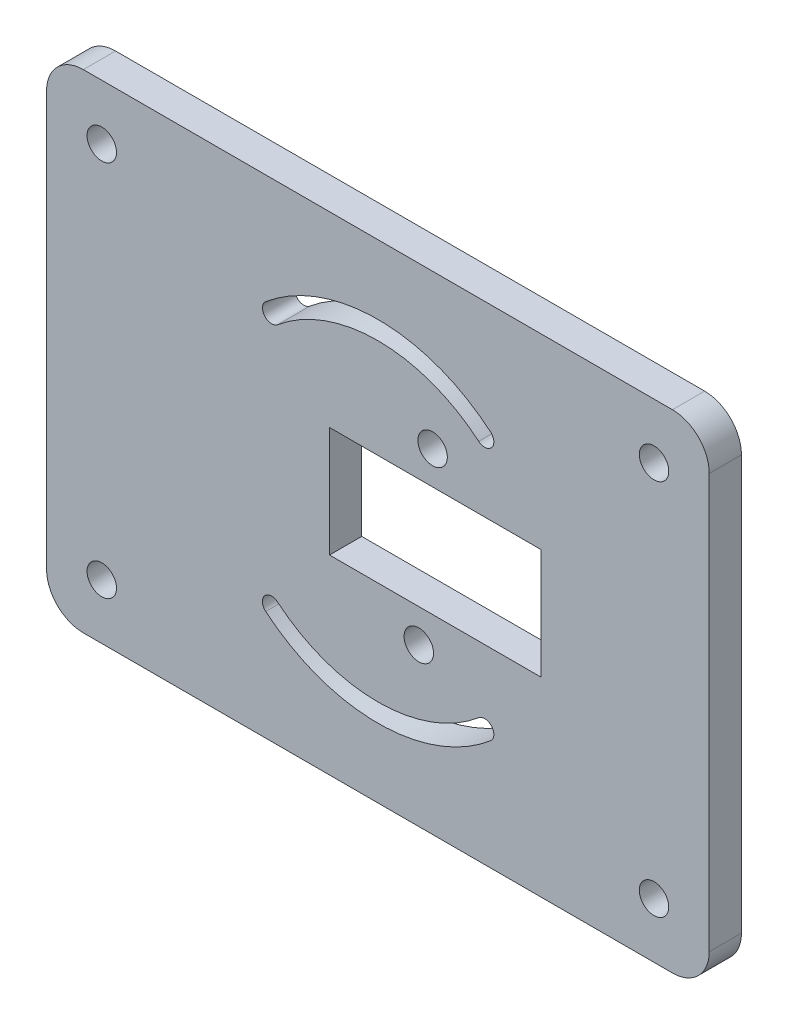
from build123d import *

# Parameters (mm, degrees)
SKETCH1_R           = 1.6
SKETCH1_W           = 23
SKETCH1_H           = 12
BOSS_EXTRUDE1_DEPTH = 3.5


with BuildPart() as part:
    # Sketch1 → Boss-Extrude1 (new body)
    with BuildSketch(Plane.XY):
        with BuildLine():
            Line((-32.044200549, -26.5), (31.955799451, -26.5))
            ThreePointArc((31.955799451, -26.5), (34.784226576, -25.328427125), (35.955799451, -22.5))
            Line((35.955799451, -22.5), (35.955799451, 22.5))
            ThreePointArc((35.955799451, 22.5), (34.784226576, 25.328427125), (31.955799451, 26.5))
            Line((31.955799451, 26.5), (-32.044200549, 26.5))
            ThreePointArc((-32.044200549, 26.5), (-34.872627673, 25.328427125), (-36.044200549, 22.5))
            Line((-36.044200549, 22.5), (-36.044200549, -22.5))
            ThreePointArc((-36.044200549, -22.5), (-34.872627673, -25.328427125), (-32.044200549, -26.5))
        make_face()
        with Locations((29.955799451, -20.5)):
            Circle(SKETCH1_R, mode=Mode.SUBTRACT)
        with Locations((29.955799451, 20.5)):
            Circle(SKETCH1_R, mode=Mode.SUBTRACT)
        with Locations((-30.044200549, 20.5)):
            Circle(SKETCH1_R, mode=Mode.SUBTRACT)
        with Locations((-30.044200549, -20.5)):
            Circle(SKETCH1_R, mode=Mode.SUBTRACT)
        with Locations((5.9, 9.8)):
            Circle(SKETCH1_R, mode=Mode.SUBTRACT)
        with Locations((4.4, -9.4)):
            Circle(SKETCH1_R, mode=Mode.SUBTRACT)
        with Locations((6.2, 0.2)):
            Rectangle(SKETCH1_W, SKETCH1_H, mode=Mode.SUBTRACT)
        with BuildLine():
            ThreePointArc((-12.229764581, -14.57779233), (-0.008459876, -18.999966384), (12.196121371, -14.531845007))
            ThreePointArc((12.196121371, -14.531845007), (12.31672785, -13.122783589), (10.907666432, -13.002177111))
            ThreePointArc((10.907666432, -13.002177111), (-0.012222052, -16.999969923), (-10.94707363, -13.043287874))
            ThreePointArc((-10.94707363, -13.043287874), (-12.355671334, -13.169194626), (-12.229764581, -14.57779233))
        make_face(mode=Mode.SUBTRACT)
        with BuildLine():
            ThreePointArc((-12.229764581, 14.57779233), (-0.008459876, 18.999966384), (12.196121371, 14.531845007))
            ThreePointArc((12.196121371, 14.531845007), (12.31672785, 13.122783589), (10.907666432, 13.002177111))
            ThreePointArc((10.907666432, 13.002177111), (-0.012222052, 16.999969923), (-10.94707363, 13.043287874))
            ThreePointArc((-10.94707363, 13.043287874), (-12.355671334, 13.169194626), (-12.229764581, 14.57779233))
        make_face(mode=Mode.SUBTRACT)
    extrude(amount=BOSS_EXTRUDE1_DEPTH)


solid = part.part
